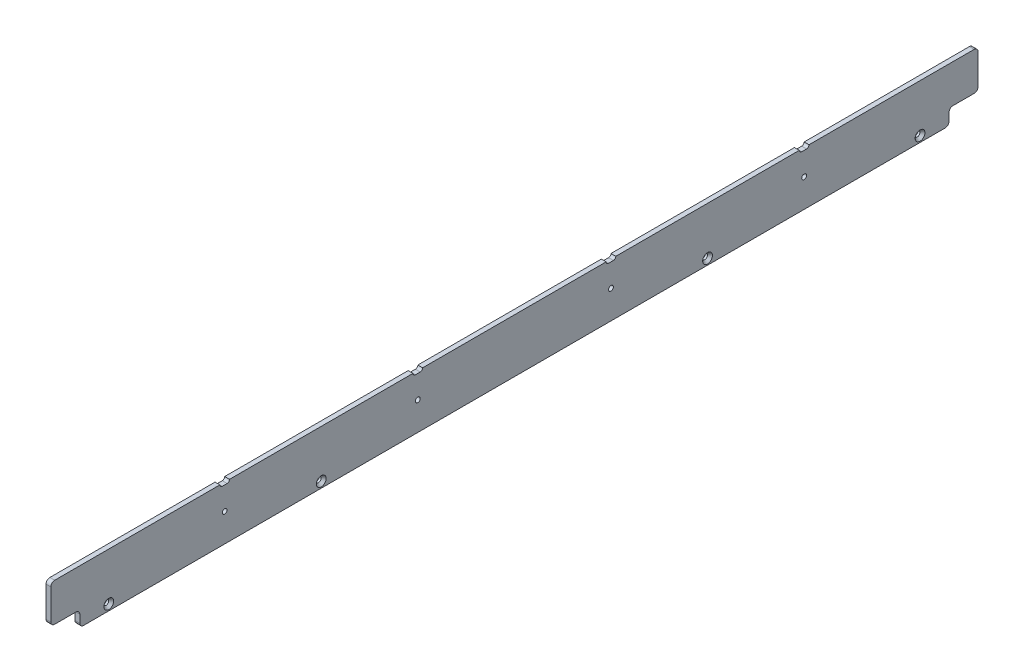
from build123d import *

# Parameters (mm, degrees)
SKETCH1_W                                     = 1219.2
SKETCH1_H                                     = 70.485
BOSS_EXTRUDE1_DEPTH                           = 6.35
CSK_FOR_1_4_FLAT_HEAD_MACHINE_SCREW1_AT_COUNT = 2
CSK_FOR_1_4_FLAT_HEAD_MACHINE_SCREW1_AT_PITCH = 279.4
CSK_FOR_1_4_FLAT_HEAD_MACHINE_SCREW1_2_COUNT  = 2
CSK_FOR_1_4_FLAT_HEAD_MACHINE_SCREW1_2_PITCH  = 787.4
CSK_FOR_1_4_FLAT_HEAD_MACHINE_SCREW1_3_COUNT  = 2
CSK_FOR_1_4_FLAT_HEAD_MACHINE_SCREW1_3_PITCH  = 1066.8
SKETCH4_W                                     = 38.1
SKETCH4_H                                     = 20.32
CUT_EXTRUDE1_DEPTH                            = 614.694237976
FILLET1_R                                     = 5.08
F_1_4_0_25_DIAMETER_HOLE1_D                   = 6.35
SKETCH7_W                                     = 12.7
SKETCH7_H                                     = 3.175
CUT_EXTRUDE2_DEPTH                            = 614.694237976
FILLET2_R                                     = 3.175


with BuildPart() as part:
    # Sketch1 → Boss-Extrude1 (new body)
    with BuildSketch(Plane(origin=(0, 0, 0), x_dir=(0, 0, -1), z_dir=(1, 0, 0))):
        with Locations((0, 35.2425)):
            Rectangle(SKETCH1_W, SKETCH1_H)
    extrude(amount=BOSS_EXTRUDE1_DEPTH)

    # Sketch3 → CSK for 1/4 Flat Head Machine Screw1 (revolve, cut)
    with BuildSketch(Plane(origin=(6.35, 7.9375, 533.4), x_dir=(0, 0, -1), z_dir=(0, 1, 0))):
        Polygon((0, 0), (0, 6.35), (3.3782, 6.35), (3.3782, 3.520932584), (6.4389, 0), align=None)
    csk_for_1_4_flat_head_machine_screw1 = revolve(axis=Axis((12.7, 7.9375, 533.4), (-1, 0, 0)), mode=Mode.SUBTRACT)

    # CSK for 1/4 Flat Head Machine Screw1 at: CSK for 1/4 Flat Head Machine Screw1 ×2
    with Locations(*[(0, 0, -i * CSK_FOR_1_4_FLAT_HEAD_MACHINE_SCREW1_AT_PITCH) for i in range(1, CSK_FOR_1_4_FLAT_HEAD_MACHINE_SCREW1_AT_COUNT)]):
        add(csk_for_1_4_flat_head_machine_screw1, mode=Mode.SUBTRACT)

    # CSK for 1_4 Flat Head Machine Screw1 2: CSK for 1/4 Flat Head Machine Screw1 ×2
    with Locations(*[(0, 0, -i * CSK_FOR_1_4_FLAT_HEAD_MACHINE_SCREW1_2_PITCH) for i in range(1, CSK_FOR_1_4_FLAT_HEAD_MACHINE_SCREW1_2_COUNT)]):
        add(csk_for_1_4_flat_head_machine_screw1, mode=Mode.SUBTRACT)

    # CSK for 1_4 Flat Head Machine Screw1 3: CSK for 1/4 Flat Head Machine Screw1 ×2
    with Locations(*[(0, 0, -i * CSK_FOR_1_4_FLAT_HEAD_MACHINE_SCREW1_3_PITCH) for i in range(1, CSK_FOR_1_4_FLAT_HEAD_MACHINE_SCREW1_3_COUNT)]):
        add(csk_for_1_4_flat_head_machine_screw1, mode=Mode.SUBTRACT)

    # Sketch4 → Cut-Extrude1 (cut, through all)
    with BuildSketch(Plane(origin=(6.35, 0, 0), x_dir=(0, 0, -1), z_dir=(1, 0, 0))):
        with Locations((-590.55, 10.16)):
            Rectangle(SKETCH4_W, SKETCH4_H)
        with Locations((590.55, 10.16)):
            Rectangle(SKETCH4_W, SKETCH4_H)
    extrude(amount=-CUT_EXTRUDE1_DEPTH, mode=Mode.SUBTRACT)

    # Fillet1
    fillet1_edges = [part.edges().sort_by_distance(p)[0] for p in [
        (3.175, 20.32, 609.6),
        (3.175, 20.32, 571.5),
        (3.175, 0, 571.5),
        (3.175, 0, -571.5),
        (3.175, 20.32, -571.5),
        (3.175, 20.32, -609.6),
        (3.175, 70.485, 609.6),
        (3.175, 70.485, -609.6),
    ]]
    fillet(fillet1_edges, radius=FILLET1_R)

    # 1/4 (0.25) Diameter Hole1 (through all)
    with Locations(Plane(origin=(6.35, 0, 0), x_dir=(0, 0, -1), z_dir=(1, 0, 0))):
        with Locations((-381, 37.1475), (-127, 37.1475), (127, 37.1475), (381, 37.1475)):
            Hole(F_1_4_0_25_DIAMETER_HOLE1_D / 2)

    # Sketch7 → Cut-Extrude2 (cut, through all)
    with BuildSketch(Plane.ZY):
        with Locations((-381, 68.8975)):
            Rectangle(SKETCH7_W, SKETCH7_H)
        with Locations((-127, 68.8975)):
            Rectangle(SKETCH7_W, SKETCH7_H)
        with Locations((127, 68.8975)):
            Rectangle(SKETCH7_W, SKETCH7_H)
        with Locations((381, 68.8975)):
            Rectangle(SKETCH7_W, SKETCH7_H)
    extrude(amount=-CUT_EXTRUDE2_DEPTH, mode=Mode.SUBTRACT)

    # Fillet2
    fillet2_edges = [part.edges().sort_by_distance(p)[0] for p in [
        (3.175, 67.31, 374.65),
        (3.175, 67.31, 387.35),
        (3.175, 67.31, 133.35),
        (3.175, 67.31, 120.65),
        (3.175, 67.31, -133.35),
        (3.175, 67.31, -120.65),
        (3.175, 67.31, -374.65),
        (3.175, 67.31, -387.35),
    ]]
    fillet(fillet2_edges, radius=FILLET2_R - 0.0001)  # a hair under: the kernel refuses the full size


solid = part.part
